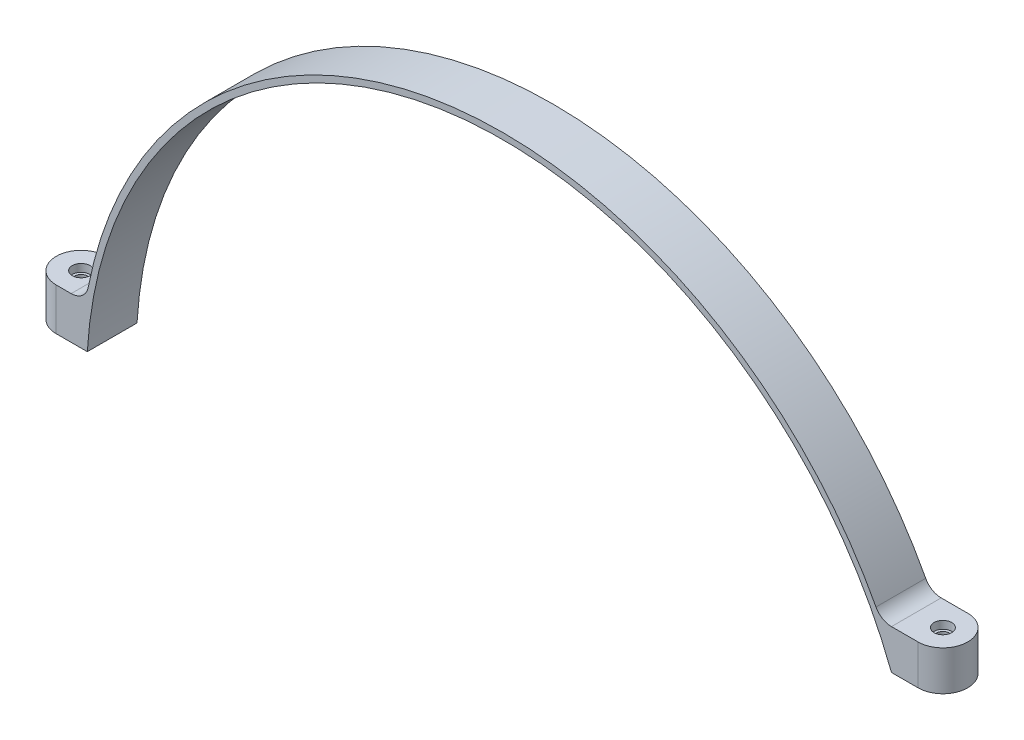
from build123d import *

# Parameters (mm, degrees)
RESSALTO_EXTRUS_O6_DEPTH  = 20
FILETE4_R                 = 10
FILETE5_R                 = 10
RESSALTO_EXTRUS_O14_DEPTH = 17
RESSALTO_EXTRUS_O15_DEPTH = 16
FILETE6_R                 = 7
FILETE7_R                 = 7
ESBO_O25_R                = 2.5
CORTE_EXTRUS_O1_DEPTH     = 16
ESBO_O27_R                = 2.5
CORTE_EXTRUS_O2_DEPTH     = 18
ESBO_O28_R                = 3.55
CORTE_EXTRUS_O3_DEPTH     = 3.1
ESBO_O29_R                = 2.5
CORTE_EXTRUS_O4_DEPTH     = 22.1
ESBO_O30_R                = 3.55
CORTE_EXTRUS_O5_DEPTH     = 3.1


# Some blends are built 0.0001 mm under size
with BuildPart() as part:
    # Esboço2 → Ressalto-extrusão6 (new body)
    with BuildSketch(Plane.XY):
        with BuildLine():
            Line((157.082780724, 65), (177.082780724, 65))
            Line((177.082780724, 65), (177.082780724, 60))
            Line((177.082780724, 60), (156.38494173, 60))
            ThreePointArc((156.38494173, 60), (-25.578272063, 165.535500719), (-167.201226072, 10))
            Line((-167.201226072, 10), (-189.705627485, 10))
            Line((-189.705627485, 10), (-189.705627485, 15))
            Line((-189.705627485, 15), (-169.336942219, 15))
            ThreePointArc((-169.336942219, 15), (-25.739874096, 168.040051421), (157.082780724, 65))
        make_face()
    extrude(amount=RESSALTO_EXTRUS_O6_DEPTH)

    # Filete4
    filete4_edges = [part.edges().sort_by_distance(p)[0] for p in [
        (177.082780724, 62.5, 0),
        (177.082780724, 62.5, 20),
    ]]
    fillet(filete4_edges, radius=FILETE4_R - 0.0001)  # a hair under: the kernel refuses the full size

    # Filete5
    filete5_edges = [part.edges().sort_by_distance(p)[0] for p in [
        (-189.705627485, 12.5, 0),
        (-189.705627485, 12.5, 20),
    ]]
    fillet(filete5_edges, radius=FILETE5_R - 0.0001)  # a hair under: the kernel refuses the full size

    # Esboço20 → Ressalto-extrusão14 (add)
    with BuildSketch(Plane.XZ.offset(-10)):
        with BuildLine():
            Line((-167.201226072, 20), (-167.201226072, 0))
            Line((-167.201226072, 0), (-179.705627485, 0))
            ThreePointArc((-179.705627485, 0), (-186.776695297, 2.928932188), (-189.705627485, 10))
            ThreePointArc((-189.705627485, 10), (-186.776695297, 17.071067812), (-179.705627485, 20))
            Line((-179.705627485, 20), (-167.201226072, 20))
        make_face()
    extrude(amount=-RESSALTO_EXTRUS_O14_DEPTH)

    # Esboço21 → Ressalto-extrusão15 (add)
    with BuildSketch(Plane.XZ.offset(-60)):
        with BuildLine():
            Line((156.38494173, 20), (156.38494173, 0))
            Line((156.38494173, 0), (167.082780724, 0))
            ThreePointArc((167.082780724, 0), (174.153848536, 2.928932188), (177.082780724, 10))
            ThreePointArc((177.082780724, 10), (174.153848536, 17.071067812), (167.082780724, 20))
            Line((167.082780724, 20), (156.38494173, 20))
        make_face()
    extrude(amount=-RESSALTO_EXTRUS_O15_DEPTH)

    # Filete6
    # the kernel refuses this fillet: 7 mm, written as the material it adds along each edge
    with BuildSketch(Plane(origin=(156.38494173, 66.66145813, 20), x_dir=(0, 1, 0), z_dir=(0, 0, -1))) as filete6_piece_1:
        with BuildLine():
            CenterArc((16.33834975, -0.051861764), FILETE6_R, 179.575501806, 62.459929256)
            Line((13.055871472, -6.234525943), (12.990221907, -6.358179227))
            ThreePointArc((12.990221907, -6.358179227), (6.533962206, -3.104642795), (-0.054897671, -0.128787599))
            Line((-0.054897671, -0.128787599), (0, 0.14))
            ThreePointArc((0, 0.14), (4.669270935, 0.14), (9.198545713, 0.001037235))
            Line((9.198545713, 0.001037235), (9.33854187, 0))
        make_face()
    extrude(amount=20)

    # Filete7
    filete7_edges = [part.edges().sort_by_distance(p)[0] for p in [
        (-167.842187784, 27, 10),
    ]]
    fillet(filete7_edges, radius=FILETE7_R)

    # Esboço25 → Corte-extrusão1 (cut)
    with BuildSketch(Plane.XZ.offset(-10)):
        with Locations((-179.705627485, 10)):
            Circle(ESBO_O25_R)
    extrude(amount=-CORTE_EXTRUS_O1_DEPTH, mode=Mode.SUBTRACT)

    # Esboço27 → Corte-extrusão2 (cut)
    with BuildSketch(Plane.XZ.offset(-10)):
        with Locations((-179.705627485, 10)):
            Circle(ESBO_O27_R)
    extrude(amount=-CORTE_EXTRUS_O2_DEPTH, mode=Mode.SUBTRACT)

    # Esboço28 → Corte-extrusão3 (cut)
    with BuildSketch(Plane(origin=(0, 27, 0), x_dir=(1, 0, 0), z_dir=(0, 1, 0))):
        with Locations(Location((-179.705627485, -10, 0), (0, 0, 180))):
            Circle(ESBO_O28_R)
    extrude(amount=-CORTE_EXTRUS_O3_DEPTH, mode=Mode.SUBTRACT)

    # Esboço29 → Corte-extrusão4 (cut)
    with BuildSketch(Plane.XZ.offset(-60)):
        with Locations(Location((167.082780724, 10, 0), (0, 0, 270))):
            Circle(ESBO_O29_R)
    extrude(amount=-CORTE_EXTRUS_O4_DEPTH, mode=Mode.SUBTRACT)

    # Esboço30 → Corte-extrusão5 (cut)
    with BuildSketch(Plane(origin=(0, 76, 0), x_dir=(1, 0, 0), z_dir=(0, 1, 0))):
        with Locations(Location((167.082780724, -10, 0), (0, 0, 270))):
            Circle(ESBO_O30_R)
    extrude(amount=-CORTE_EXTRUS_O5_DEPTH, mode=Mode.SUBTRACT)


solid = part.part
